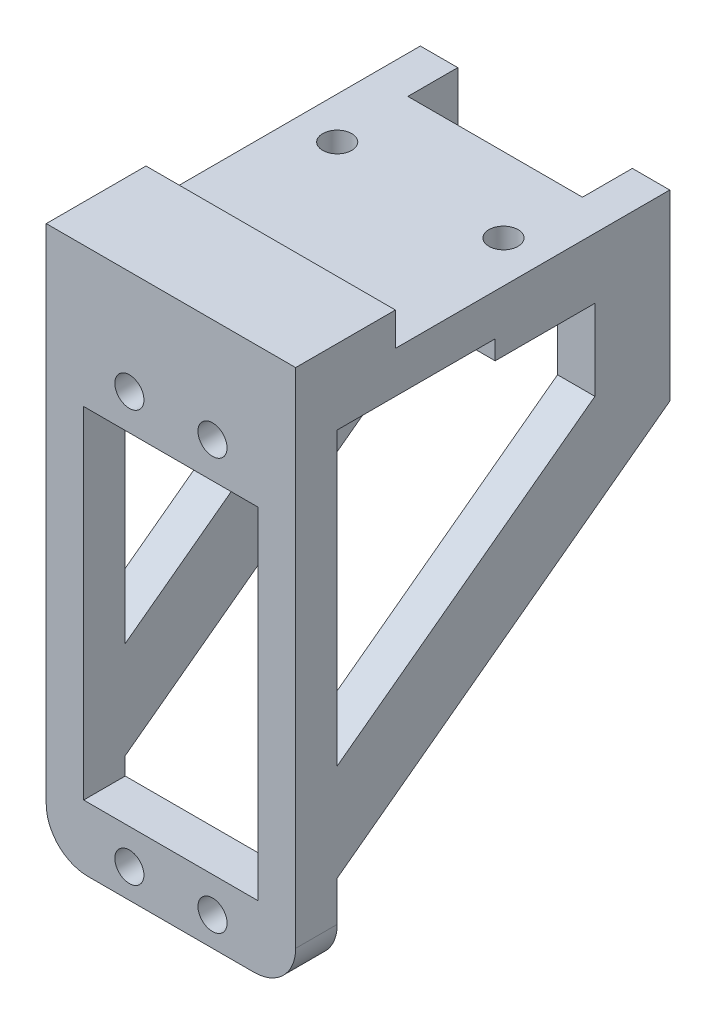
from build123d import *

# Parameters (mm, degrees)
SKETCH_1_W          = 30
SKETCH_1_H          = 61.5
EXTRUDE_1_DEPTH     = 5
SKETCH_2_R          = 1.75
SKETCH_2_W          = 21
SKETCH_2_H          = 41
CUT_EXTRUDE_1_DEPTH = 69.609401688
SKETCH_3_W          = 30
SKETCH_3_H          = 40
EXTRUDE_2_DEPTH     = 5
SKETCH_4_R          = 1.75
CUT_EXTRUDE_2_DEPTH = 80.260645973
SKETCH_5_W          = 10
SKETCH_5_H          = 12
EXTRUDE_3_DEPTH     = 2.3
SKETCH_6_W          = 30
SKETCH_6_H          = 12
EXTRUDE_4_DEPTH     = 4
EXTRUDE_5_DEPTH     = 4.5
FILLET_1_R          = 5
SKETCH_8_W          = 21
SKETCH_8_H          = 6
CUT_EXTRUDE_3_DEPTH = 76.447001266


with BuildPart() as part:
    # ｽｹｯﾁ1 → ﾎﾞｽ - 押し出し1 (new body)
    with BuildSketch(Plane.XY):
        with Locations((15, 30.75)):
            Rectangle(SKETCH_1_W, SKETCH_1_H)
    extrude(amount=EXTRUDE_1_DEPTH)

    # ｽｹｯﾁ2 → ｶｯﾄ - 押し出し1 (cut, through all)
    with BuildSketch(Plane.XY.offset(5)):
        with Locations((10, 3.5)):
            Circle(SKETCH_2_R)
        with Locations((20, 3.5)):
            Circle(SKETCH_2_R)
        with Locations((10, 53)):
            Circle(SKETCH_2_R)
        with Locations((20, 53)):
            Circle(SKETCH_2_R)
        with Locations((15, 28.2)):
            Rectangle(SKETCH_2_W, SKETCH_2_H)
    extrude(amount=-CUT_EXTRUDE_1_DEPTH, mode=Mode.SUBTRACT)

    # ｽｹｯﾁ3 → ﾎﾞｽ - 押し出し2 (add)
    with BuildSketch(Plane(origin=(0, 61.5, 0), x_dir=(1, 0, 0), z_dir=(0, 1, 0))):
        with Locations((15, 20)):
            Rectangle(SKETCH_3_W, SKETCH_3_H)
    extrude(amount=-EXTRUDE_2_DEPTH)

    # ｽｹｯﾁ4 → ｶｯﾄ - 押し出し2 (cut, through all)
    with BuildSketch(Plane(origin=(0, 61.5, 0), x_dir=(1, 0, 0), z_dir=(0, 1, 0))):
        with Locations((5, 25)):
            Circle(SKETCH_4_R)
        with Locations((25, 25)):
            Circle(SKETCH_4_R)
    extrude(amount=-CUT_EXTRUDE_2_DEPTH, mode=Mode.SUBTRACT)

    # ｽｹｯﾁ5 → ﾎﾞｽ - 押し出し3 (add)
    # profile 1 of 2: a face of its own
    with BuildSketch(Plane.XZ.offset(-56.5)):
        with Locations((5, -25)):
            Rectangle(SKETCH_5_W, SKETCH_5_H)
        Polygon((5, -28.6), (8.117691454, -26.8), (8.117691454, -23.2), (5, -21.4), (1.882308546, -23.2), (1.882308546, -26.8), align=None, mode=Mode.SUBTRACT)
    # profile 2 of 2: a face of its own
    with BuildSketch(Plane.XZ.offset(-56.5)):
        with Locations((25, -25)):
            Rectangle(SKETCH_5_W, SKETCH_5_H)
        Polygon((28.117691454, -26.8), (25, -28.6), (21.882308546, -26.8), (21.882308546, -23.2), (25, -21.4), (28.117691454, -23.2), align=None, mode=Mode.SUBTRACT)
    extrude(amount=EXTRUDE_3_DEPTH)

    # ｽｹｯﾁ6 → ﾎﾞｽ - 押し出し4 (add)
    with BuildSketch(Plane(origin=(0, 61.5, 0), x_dir=(1, 0, 0), z_dir=(0, 1, 0))):
        with Locations((15, 1)):
            Rectangle(SKETCH_6_W, SKETCH_6_H)
    extrude(amount=EXTRUDE_4_DEPTH)

    # ｽｹｯﾁ7 → ﾎﾞｽ - 押し出し5 (add)
    with BuildSketch(Plane(origin=(30, 0, 0), x_dir=(0, 0, -1), z_dir=(1, 0, 0))):
        Polygon((40, 56.5), (40, 39.5), (0, 9.822580645), (0, 21.5), (31, 44.5), (31, 56.5), align=None)
    extrude_5 = extrude(amount=-EXTRUDE_5_DEPTH)

    # ﾐﾗｰ1: ﾎﾞｽ - 押し出し5 across plane
    add(extrude_5.mirror(Plane.ZY.offset(-15)))

    # ﾌｨﾚｯﾄ1
    fillet_1_edges = [part.edges().sort_by_distance(p)[0] for p in [
        (0, 0, 2.5),
        (30, 0, 2.5),
    ]]
    fillet(fillet_1_edges, radius=FILLET_1_R)

    # ｽｹｯﾁ8 → ｶｯﾄ - 押し出し3 (cut, through all)
    with BuildSketch(Plane.XZ.offset(-56.5)):
        with Locations((15, -37)):
            Rectangle(SKETCH_8_W, SKETCH_8_H)
    extrude(amount=-CUT_EXTRUDE_3_DEPTH, mode=Mode.SUBTRACT)


solid = part.part
